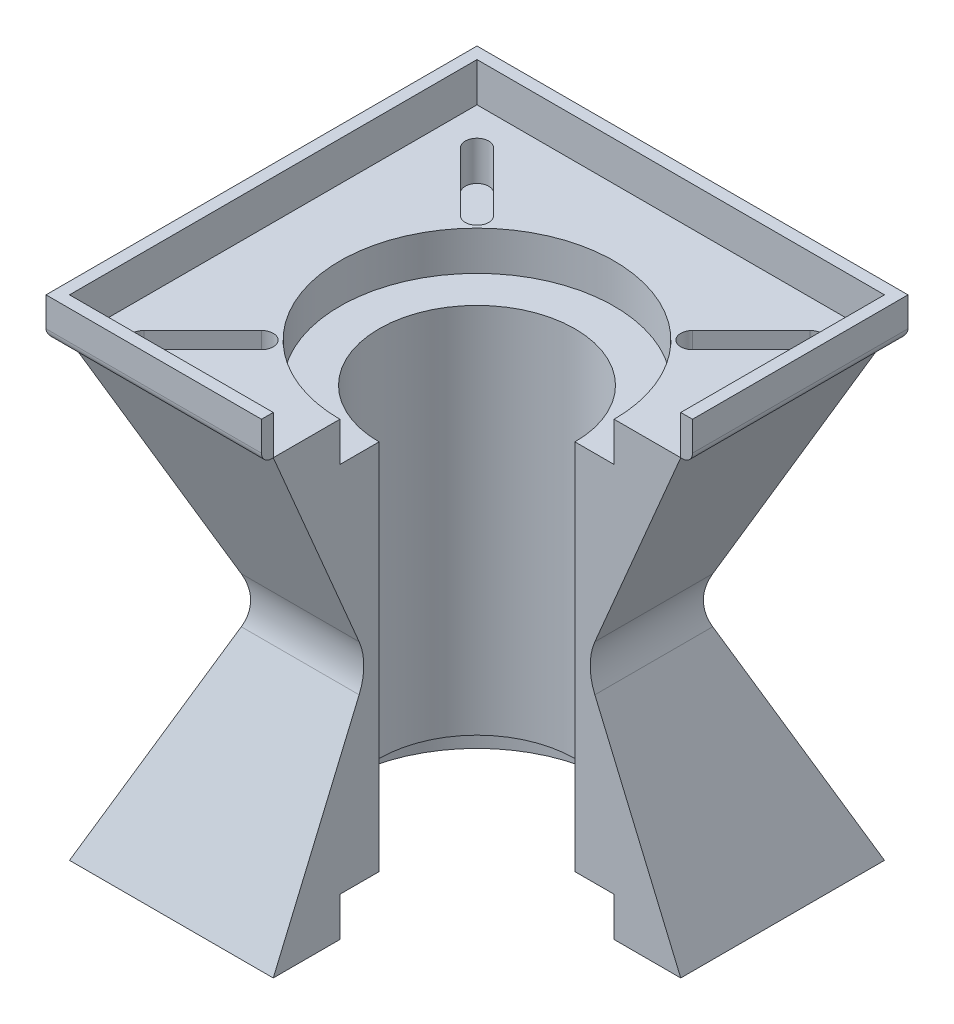
from build123d import *

# Parameters (mm, degrees)
SKETCH2_W               = 104
SKETCH2_H               = 104
BOSS_EXTRUDE1_DEPTH     = 57.5
BOSS_EXTRUDE1_TAPER     = 23
CUT_EXTRUDE1_DEPTH      = 187.700294763
CUT_EXTRUDE1_DEPTH_BACK = 187.700294763
SKETCH4_R               = 25
FILLET1_R               = 15
SKETCH5_R               = 35
CUT_EXTRUDE2_DEPTH      = 10
CUT_EXTRUDE3_START      = -10
SKETCH6_R               = 35
CUT_EXTRUDE3_DEPTH      = 10
SKETCH7_W               = 52
SKETCH7_H               = 52
CUT_EXTRUDE4_DEPTH      = 187.700294763
BOSS_EXTRUDE3_DEPTH     = 10
FILLET12_R              = 2.5
CUT_EXTRUDE5_DEPTH      = 10


with BuildPart() as part:
    # Sketch2 → Boss-Extrude1 (new body)
    with BuildSketch(Plane(origin=(0, 0, 0), x_dir=(1, 0, 0), z_dir=(0, 1, 0))):
        with Locations((52, 52)):
            Rectangle(SKETCH2_W, SKETCH2_H)
    extrude(amount=BOSS_EXTRUDE1_DEPTH, taper=BOSS_EXTRUDE1_TAPER)

    # Mirror2: part across plane


with BuildPart() as part_1:
    add(part.part)
    add(part.part.mirror(Plane(origin=(0, 57.5, 0), x_dir=(0, 0, 1), z_dir=(0, -1, 0))))

    # Sketch4 → Cut-Extrude1 (cut, two sides: drawn at the far end of the back side and taken through both)
    with BuildSketch(Plane(origin=(0, 115, 0), x_dir=(1, 0, 0), z_dir=(0, 1, 0)).offset(-CUT_EXTRUDE1_DEPTH_BACK)):
        with Locations(Location((52, 52, 0), (0, 0, 270))):
            Circle(SKETCH4_R)
    extrude(amount=CUT_EXTRUDE1_DEPTH + CUT_EXTRUDE1_DEPTH_BACK, mode=Mode.SUBTRACT)

    # Fillet1
    # the kernel refuses this fillet: 15 mm, written as the material it adds along each edge
    with BuildSketch(Plane(origin=(24.407301932, 57.5, -95.510503676), x_dir=(-0.39073112848927455, -0.9205048534524399, 0), z_dir=(0, 0, 1))) as fillet1_piece_1_section:
        with BuildLine():
            CenterArc((FILLET1_R * 0.42447481621, -FILLET1_R), FILLET1_R, 90, 46)
            Line((-FILLET1_R * 0.294864984129, -FILLET1_R * 0.305341629541), (0, 0))
            Line((0, 0), (FILLET1_R * 0.42447481621, 0))
        make_face()
    fillet1_piece_1 = extrude(amount=87.021007352, mode=Mode.PRIVATE)
    fillet1_piece_1 = fillet1_piece_1 - Plane(origin=(24.407301932, 57.5, -8.111896271), x_dir=(0, -0.39073112848927466, -0.9205048534524399), z_dir=(-1, 0, 0)) * Cylinder(15, 200, mode=Mode.PRIVATE)
    fillet1_piece_1 = fillet1_piece_1 - Plane(origin=(24.407301932, 57.5, -95.888103729), x_dir=(0, -0.3907311284892748, 0.9205048534524398), z_dir=(1, 0, 0)) * Cylinder(15, 200, mode=Mode.PRIVATE)
    add(fillet1_piece_1)
    with BuildSketch(Plane(origin=(8.489496324, 57.5, -24.407301932), x_dir=(0, -0.9205048534524399, 0.39073112848927455), z_dir=(1, 0, 0))) as fillet1_piece_2_section:
        with BuildLine():
            CenterArc((FILLET1_R * 0.42447481621, -FILLET1_R), FILLET1_R, 90, 46)
            Line((-FILLET1_R * 0.294864984129, -FILLET1_R * 0.305341629541), (0, 0))
            Line((0, 0), (FILLET1_R * 0.42447481621, 0))
        make_face()
    fillet1_piece_2 = extrude(amount=87.021007352, mode=Mode.PRIVATE)
    fillet1_piece_2 = fillet1_piece_2 - Plane(origin=(95.888103729, 57.5, -24.407301932), x_dir=(-0.9205048534524398, -0.3907311284892748, 0), z_dir=(0, 0, 1)) * Cylinder(15, 200, mode=Mode.PRIVATE)
    fillet1_piece_2 = fillet1_piece_2 - Plane(origin=(8.111896271, 57.5, -24.407301932), x_dir=(0.9205048534524399, -0.39073112848927466, 0), z_dir=(0, 0, -1)) * Cylinder(15, 200, mode=Mode.PRIVATE)
    add(fillet1_piece_2)
    with BuildSketch(Plane(origin=(79.592698068, 57.5, -8.489496324), x_dir=(0.39073112848927455, -0.9205048534524399, 0), z_dir=(0, 0, -1))) as fillet1_piece_3_section:
        with BuildLine():
            CenterArc((FILLET1_R * 0.42447481621, -FILLET1_R), FILLET1_R, 90, 46)
            Line((-FILLET1_R * 0.294864984129, -FILLET1_R * 0.305341629541), (0, 0))
            Line((0, 0), (FILLET1_R * 0.42447481621, 0))
        make_face()
    fillet1_piece_3 = extrude(amount=87.021007352, mode=Mode.PRIVATE)
    fillet1_piece_3 = fillet1_piece_3 - Plane(origin=(79.592698068, 57.5, -8.111896271), x_dir=(0, -0.39073112848927466, -0.9205048534524399), z_dir=(-1, 0, 0)) * Cylinder(15, 200, mode=Mode.PRIVATE)
    fillet1_piece_3 = fillet1_piece_3 - Plane(origin=(79.592698068, 57.5, -95.888103729), x_dir=(0, -0.3907311284892748, 0.9205048534524398), z_dir=(1, 0, 0)) * Cylinder(15, 200, mode=Mode.PRIVATE)
    add(fillet1_piece_3)
    with BuildSketch(Plane(origin=(95.510503676, 57.5, -79.592698068), x_dir=(0, -0.9205048534524399, -0.39073112848927455), z_dir=(-1, 0, 0))) as fillet1_piece_4_section:
        with BuildLine():
            CenterArc((FILLET1_R * 0.42447481621, -FILLET1_R), FILLET1_R, 90, 46)
            Line((-FILLET1_R * 0.294864984129, -FILLET1_R * 0.305341629541), (0, 0))
            Line((0, 0), (FILLET1_R * 0.42447481621, 0))
        make_face()
    fillet1_piece_4 = extrude(amount=87.021007352, mode=Mode.PRIVATE)
    fillet1_piece_4 = fillet1_piece_4 - Plane(origin=(95.888103729, 57.5, -79.592698068), x_dir=(-0.9205048534524398, -0.3907311284892748, 0), z_dir=(0, 0, 1)) * Cylinder(15, 200, mode=Mode.PRIVATE)
    fillet1_piece_4 = fillet1_piece_4 - Plane(origin=(8.111896271, 57.5, -79.592698068), x_dir=(0.9205048534524399, -0.39073112848927466, 0), z_dir=(0, 0, -1)) * Cylinder(15, 200, mode=Mode.PRIVATE)
    add(fillet1_piece_4)

    # Sketch5 → Cut-Extrude2 (cut)
    with BuildSketch(Plane(origin=(0, 115, 0), x_dir=(1, 0, 0), z_dir=(0, 1, 0))):
        with Locations(Location((52, 52, 0), (0, 0, 270))):
            Circle(SKETCH5_R)
    extrude(amount=-CUT_EXTRUDE2_DEPTH, mode=Mode.SUBTRACT)

    # Sketch6 → Cut-Extrude3 (cut)
    with BuildSketch(Plane.XZ.offset(CUT_EXTRUDE3_START)):
        with Locations(Location((52, -52, 0), (0, 0, 90))):
            Circle(SKETCH6_R)
    extrude(amount=CUT_EXTRUDE3_DEPTH, mode=Mode.SUBTRACT)

    # Sketch7 → Cut-Extrude4 (cut, through all)
    with BuildSketch(Plane(origin=(0, 115, 0), x_dir=(1, 0, 0), z_dir=(0, 1, 0))):
        with Locations((78, 26)):
            Rectangle(SKETCH7_W, SKETCH7_H)
    extrude(amount=-CUT_EXTRUDE4_DEPTH, mode=Mode.SUBTRACT)

    # Sketch10 → Cut-Extrude5 (cut)
    with BuildSketch(Plane(origin=(0, 115, 0), x_dir=(1, 0, 0), z_dir=(0, 1, 0))):
        with BuildLine():
            Line((11.621320344, 96.621320344), (26.621320344, 81.621320344))
            ThreePointArc((26.621320344, 81.621320344), (26.621320344, 77.378679656), (22.378679656, 77.378679656))
            Line((22.378679656, 77.378679656), (7.378679656, 92.378679656))
            ThreePointArc((7.378679656, 92.378679656), (7.378679656, 96.621320344), (11.621320344, 96.621320344))
        make_face()
        with BuildLine():
            Line((92.378679656, 96.621320344), (77.378679656, 81.621320344))
            ThreePointArc((77.378679656, 81.621320344), (77.378679656, 77.378679656), (81.621320344, 77.378679656))
            Line((81.621320344, 77.378679656), (96.621320344, 92.378679656))
            ThreePointArc((96.621320344, 92.378679656), (96.621320344, 96.621320344), (92.378679656, 96.621320344))
        make_face()
        with BuildLine():
            Line((11.621320344, 7.378679656), (26.621320344, 22.378679656))
            ThreePointArc((26.621320344, 22.378679656), (26.621320344, 26.621320344), (22.378679656, 26.621320344))
            Line((22.378679656, 26.621320344), (7.378679656, 11.621320344))
            ThreePointArc((7.378679656, 11.621320344), (7.378679656, 7.378679656), (11.621320344, 7.378679656))
        make_face()
    extrude(amount=-CUT_EXTRUDE5_DEPTH, mode=Mode.SUBTRACT)


with BuildPart() as body_2:
    # Sketch8 → Boss-Extrude3 (new body)
    with BuildSketch(Plane(origin=(0, 115, 0), x_dir=(1, 0, 0), z_dir=(0, 1, 0))):
        Polygon((104, 52), (104, 104), (0, 104), (0, 0), (52, 0), (52, -3), (-3, -3), (-3, 107), (107, 107), (107, 52), align=None)
    extrude(amount=BOSS_EXTRUDE3_DEPTH)

    # Fillet12
    fillet12_edges = [body_2.edges().sort_by_distance(p)[0] for p in [
        (24.5, 115, 3),
        (-3, 115, -52),
        (52, 115, -107),
        (107, 115, -79.5),
    ]]
    fillet(fillet12_edges, radius=FILLET12_R)


solid = Compound([part_1.part, body_2.part])
